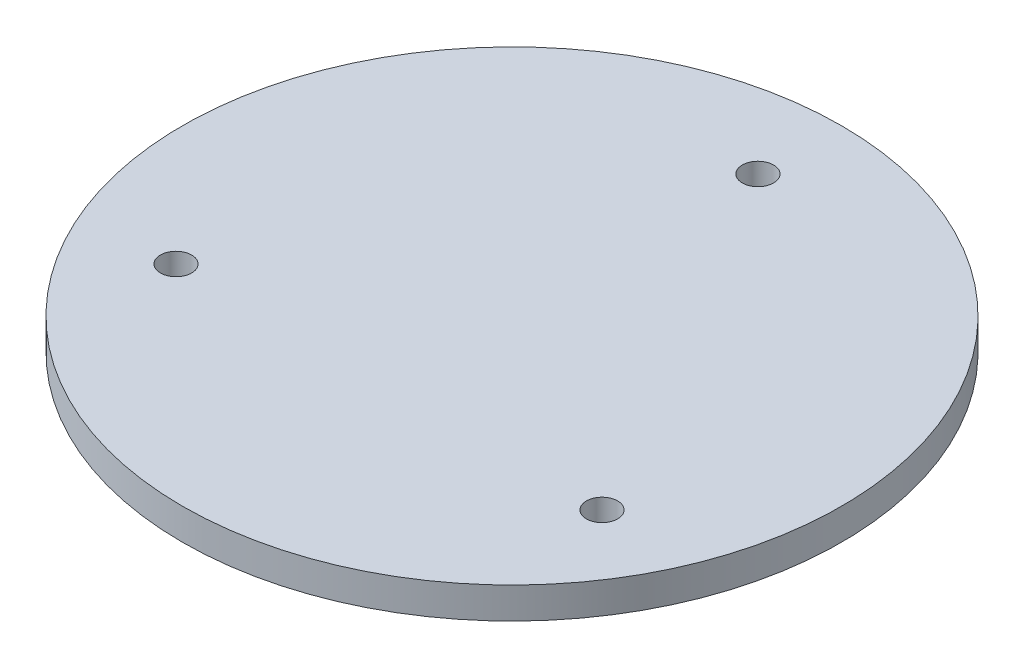
from build123d import *

# Parameters (mm, degrees)
SKETCH1_R           = 134
SKETCH1_R_2         = 6.35
BOSS_EXTRUDE1_DEPTH = 12.7


with BuildPart() as part:
    # Sketch1 → Boss-Extrude1 (new body)
    with BuildSketch(Plane(origin=(0, 0, 0), x_dir=(1, 0, 0), z_dir=(0, 1, 0))):
        Circle(SKETCH1_R)
        with Locations((0, 100)):
            Circle(SKETCH1_R_2, mode=Mode.SUBTRACT)
        with Locations((86.602540378, -50)):
            Circle(SKETCH1_R_2, mode=Mode.SUBTRACT)
        with Locations((-86.602540378, -50)):
            Circle(SKETCH1_R_2, mode=Mode.SUBTRACT)
    extrude(amount=BOSS_EXTRUDE1_DEPTH)


solid = part.part
